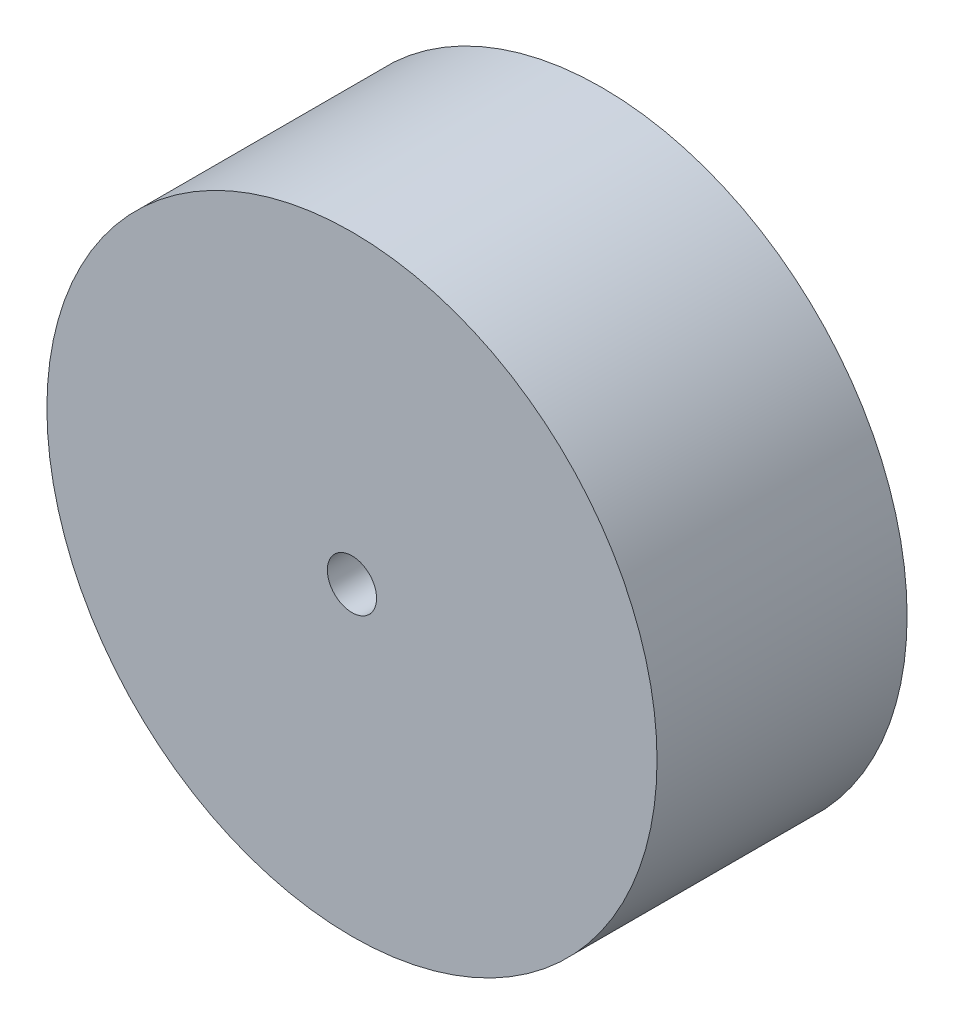
from build123d import *

# Parameters (mm, degrees)
SKETCH1_R           = 30.988
SKETCH1_R_2         = 2.5
BOSS_EXTRUDE1_DEPTH = 25.4


with BuildPart() as part:
    # Sketch1 → Boss-Extrude1 (new body)
    with BuildSketch(Plane.XY):
        Circle(SKETCH1_R)
        Circle(SKETCH1_R_2, mode=Mode.SUBTRACT)
    extrude(amount=BOSS_EXTRUDE1_DEPTH)


solid = part.part
